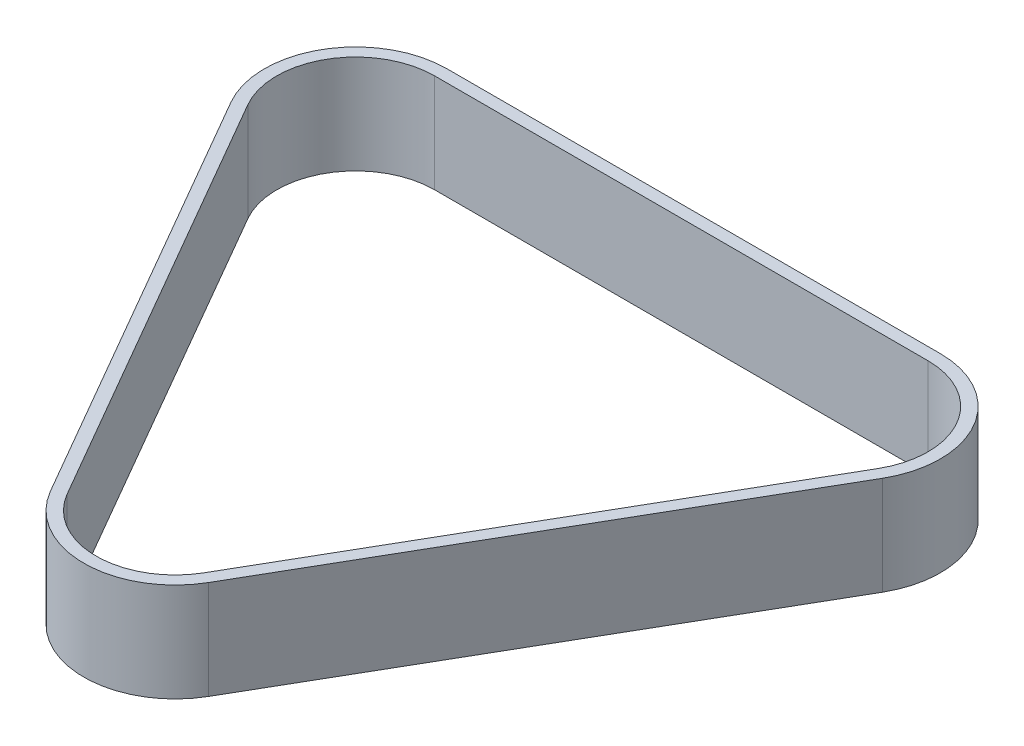
from build123d import *

# Parameters (mm, degrees)
BOSS_EXTRUDE1_DEPTH = 20


with BuildPart() as part:
    # Sketch1 → Boss-Extrude1 (new body)
    with BuildSketch(Plane(origin=(0, 0, 0), x_dir=(1, 0, 0), z_dir=(0, 1, 0))):
        with BuildLine():
            ThreePointArc((0, 18.5), (-16.02146997, 9.25), (-16.02146997, -9.25))
            Line((-16.02146997, -9.25), (33.97853003, -95.852540378))
            ThreePointArc((33.97853003, -95.852540378), (50, -105.102540378), (66.02146997, -95.852540378))
            Line((66.02146997, -95.852540378), (116.02146997, -9.25))
            ThreePointArc((116.02146997, -9.25), (116.02146997, 9.25), (100, 18.5))
            Line((100, 18.5), (0, 18.5))
        make_face()
        with BuildLine():
            ThreePointArc((-13.856406461, -8), (-13.856406461, 8), (0, 16))
            Line((0, 16), (100, 16))
            ThreePointArc((100, 16), (113.856406461, 8), (113.856406461, -8))
            Line((113.856406461, -8), (63.856406461, -94.602540378))
            ThreePointArc((63.856406461, -94.602540378), (50, -102.602540378), (36.143593539, -94.602540378))
            Line((36.143593539, -94.602540378), (-13.856406461, -8))
        make_face(mode=Mode.SUBTRACT)
    extrude(amount=BOSS_EXTRUDE1_DEPTH)


solid = part.part
